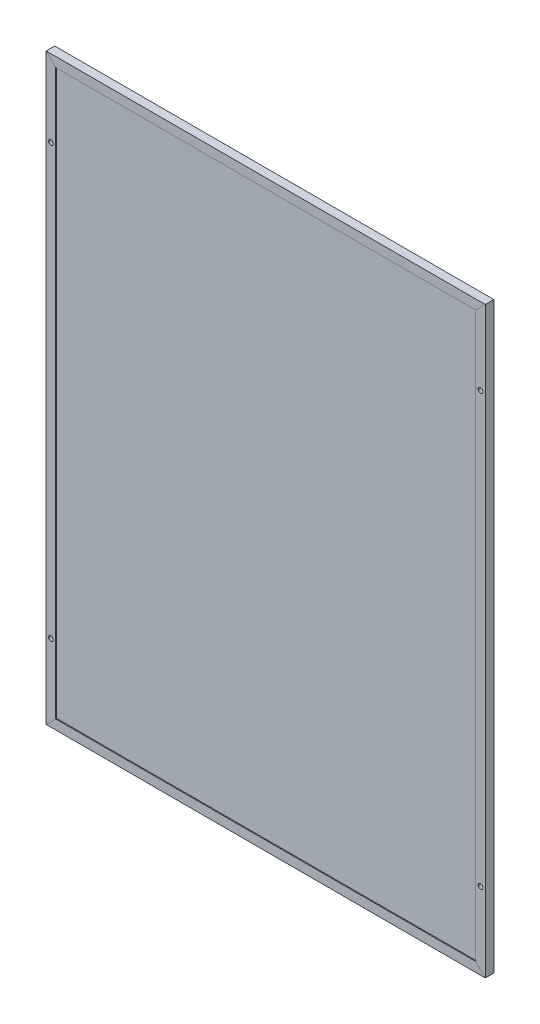
from build123d import *

# Parameters (mm, degrees)
SKETCH1_W                  = 458
SKETCH1_H                  = 609
BOSS_EXTRUDE1_DEPTH        = 2.5
BOSS_EXTRUDE2_DEPTH        = 305.5
BOSS_EXTRUDE2_DEPTH_BACK   = 305.5
BOSS_EXTRUDE2_2_DEPTH      = 305.5
BOSS_EXTRUDE2_2_DEPTH_BACK = 305.5
CUT_EXTRUDE1_DEPTH         = 383.440191403
CUT_EXTRUDE1_DEPTH_BACK    = 383.440191403
BOSS_EXTRUDE3_START        = -5.5
BOSS_EXTRUDE3_DEPTH        = 1
BOSS_EXTRUDE3_START_2      = 2.5
BOSS_EXTRUDE3_2_DEPTH      = 1
BOSS_EXTRUDE3_START_3      = -4.5
BOSS_EXTRUDE3_3_DEPTH      = 7
BOSS_EXTRUDE3_4_DEPTH      = 1
BOSS_EXTRUDE3_5_DEPTH      = 1
BOSS_EXTRUDE3_6_DEPTH      = 7
CUT_EXTRUDE2_DEPTH         = 383.440191403
CUT_EXTRUDE2_DEPTH_BACK    = 383.440191403
SKETCH5_R                  = 2.5


# Read off the part's stored shape, not the designer's step: Boss-Extrude3
with BuildPart() as part:
    # Sketch1 → Boss-Extrude1 (new, symmetric)
    with BuildSketch(Plane.XY):
        Rectangle(SKETCH1_W, SKETCH1_H)
    extrude(amount=BOSS_EXTRUDE1_DEPTH, both=True)


with BuildPart() as body_2:
    # Sketch2 → Boss-Extrude2 (new, two sides: drawn at the far end of the back side and taken through both)
    with BuildSketch(Plane(origin=(0, 0, 0), x_dir=(1, 0, 0), z_dir=(0, 1, 0)).offset(-BOSS_EXTRUDE2_DEPTH_BACK)):
        Polygon((-229, -2.5), (-220, -2.5), (-220, -3.5), (-230, -3.5), (-230, 5.5), (-220, 5.5), (-220, 4.5), (-229, 4.5), align=None)
    extrude(amount=BOSS_EXTRUDE2_DEPTH + BOSS_EXTRUDE2_DEPTH_BACK)


with BuildPart() as body_3:
    # Sketch2 → Boss-Extrude2 2 (new, two sides: drawn at the far end of the back side and taken through both)
    with BuildSketch(Plane(origin=(0, 0, 0), x_dir=(1, 0, 0), z_dir=(0, 1, 0)).offset(-BOSS_EXTRUDE2_2_DEPTH_BACK)):
        Polygon((229, 4.5), (229, -2.5), (220, -2.5), (220, -3.5), (230, -3.5), (230, 5.5), (220, 5.5), (220, 4.5), align=None)
    extrude(amount=BOSS_EXTRUDE2_2_DEPTH + BOSS_EXTRUDE2_2_DEPTH_BACK)


with BuildPart() as cut_extrude1_tool:
    # Sketch3 → Cut-Extrude1 (new, two sides: drawn at the far end of the back side and taken through both)
    with BuildSketch(Plane.XY.offset(-CUT_EXTRUDE1_DEPTH_BACK)):
        Polygon((-230, 305.5), (-220, 295.5), (-220, 305.5), align=None)
        Polygon((220, 305.5), (230, 305.5), (220, 295.5), align=None)
        Polygon((230, -305.5), (220, -295.5), (220, -305.5), align=None)
        Polygon((-220, -305.5), (-230, -305.5), (-220, -295.5), align=None)
    extrude(amount=CUT_EXTRUDE1_DEPTH + CUT_EXTRUDE1_DEPTH_BACK)


with BuildPart() as body_2_1:
    add(body_2.part)

    # Cut-Extrude1: cut by cut_extrude1_tool
    add(cut_extrude1_tool.part, mode=Mode.SUBTRACT)


with BuildPart() as body_3_1:
    add(body_3.part)

    # Cut-Extrude1: cut by cut_extrude1_tool
    add(cut_extrude1_tool.part, mode=Mode.SUBTRACT)


with BuildPart() as body_4:
    # Boss-Extrude3 outline → Boss-Extrude3 (new body)
    with BuildSketch(Plane.XY.offset(BOSS_EXTRUDE3_START)):
        Polygon((220, -295.5), (-220, -295.5), (-230, -305.5), (230, -305.5), align=None)
    extrude(amount=BOSS_EXTRUDE3_DEPTH)

    # Boss-Extrude3 2 outline → Boss-Extrude3 2 (add)
    with BuildSketch(Plane.XY.offset(BOSS_EXTRUDE3_START_2)):
        Polygon((220, -295.5), (-220, -295.5), (-230, -305.5), (230, -305.5), align=None)
    extrude(amount=BOSS_EXTRUDE3_2_DEPTH)

    # Boss-Extrude3 3 outline → Boss-Extrude3 3 (add)
    with BuildSketch(Plane.XY.offset(BOSS_EXTRUDE3_START_3)):
        Polygon((229, -304.5), (-229, -304.5), (-230, -305.5), (230, -305.5), align=None)
    extrude(amount=BOSS_EXTRUDE3_3_DEPTH)


with BuildPart() as body_5:
    # Boss-Extrude3 4 outline → Boss-Extrude3 4 (new body)
    with BuildSketch(Plane.XY.offset(BOSS_EXTRUDE3_START)):
        Polygon((230, 305.5), (-230, 305.5), (-220, 295.5), (220, 295.5), align=None)
    extrude(amount=BOSS_EXTRUDE3_4_DEPTH)

    # Boss-Extrude3 5 outline → Boss-Extrude3 5 (add)
    with BuildSketch(Plane.XY.offset(BOSS_EXTRUDE3_START_2)):
        Polygon((230, 305.5), (-230, 305.5), (-220, 295.5), (220, 295.5), align=None)
    extrude(amount=BOSS_EXTRUDE3_5_DEPTH)

    # Boss-Extrude3 6 outline → Boss-Extrude3 6 (add)
    with BuildSketch(Plane.XY.offset(BOSS_EXTRUDE3_START_3)):
        Polygon((230, 305.5), (-230, 305.5), (-229, 304.5), (229, 304.5), align=None)
    extrude(amount=BOSS_EXTRUDE3_6_DEPTH)


with BuildPart() as cut_extrude2_tool:
    # Sketch5 → Cut-Extrude2 (new, two sides: drawn at the far end of the back side and taken through both)
    with BuildSketch(Plane.XY.offset(-CUT_EXTRUDE2_DEPTH_BACK)):
        with Locations((-225, 225)):
            Circle(SKETCH5_R)
        with Locations(Location((-225, -225, 0), (0, 0, 180))):
            Circle(SKETCH5_R)
        with Locations((225, -225)):
            Circle(SKETCH5_R)
        with Locations(Location((225, 225, 0), (0, 0, 180))):
            Circle(SKETCH5_R)
    extrude(amount=CUT_EXTRUDE2_DEPTH + CUT_EXTRUDE2_DEPTH_BACK)


with BuildPart() as part_1:
    add(part.part)

    # Cut-Extrude2: cut by cut_extrude2_tool
    add(cut_extrude2_tool.part, mode=Mode.SUBTRACT)


with BuildPart() as body_2_2:
    add(body_2_1.part)

    # Cut-Extrude2: cut by cut_extrude2_tool
    add(cut_extrude2_tool.part, mode=Mode.SUBTRACT)


with BuildPart() as body_3_2:
    add(body_3_1.part)

    # Cut-Extrude2: cut by cut_extrude2_tool
    add(cut_extrude2_tool.part, mode=Mode.SUBTRACT)


solid = Compound([body_4.part, body_5.part, part_1.part, body_2_2.part, body_3_2.part])
